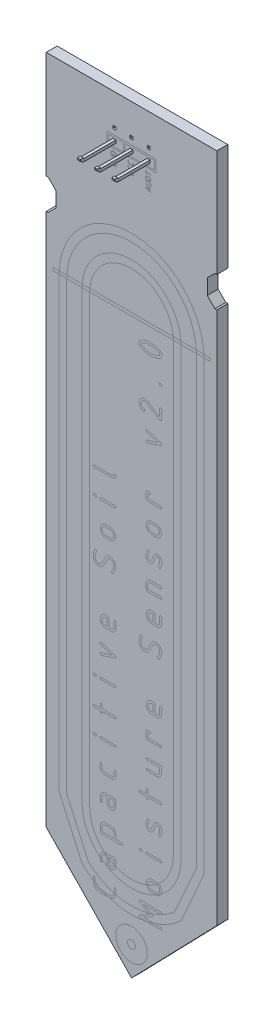
from build123d import *

# Parameters (mm, degrees)
BOSS_EXTRUDE1_DEPTH = 0.715
CUT_EXTRUDE1_REACH  = 52.858
SKETCH7_W           = 10
SKETCH7_H           = 7.4
BOSS_EXTRUDE2_DEPTH = 4.585833323
SHELL1_T            = -0.2
CUT_EXTRUDE2_DEPTH  = 0.2
CUT_EXTRUDE3_REACH  = 56.48
SKETCH10_W          = 0.7
SKETCH10_H          = 2.9
SKETCH11_W          = 9.6
SKETCH11_H          = 0.7
BOSS_EXTRUDE3_DEPTH = 0.2
SKETCH12_W          = 1.5
SKETCH12_H          = 4.6
CUT_EXTRUDE4_DEPTH  = 0.1
SWEEP1_START        = -2.44
SWEEP1_OUTLINE_W    = 0.38
SWEEP1_OUTLINE_H    = 1.2
SWEEP1_DEPTH        = 0.38
LPATTERN1_COUNT     = 3
LPATTERN1_PITCH     = 2.25
CHAMFER3_SIZE       = 0.1
CUT_EXTRUDE6_REACH  = 55.292
SKETCH18_W          = 0.38
SKETCH18_H          = 0.38
CUT_EXTRUDE7_START  = 5.355
SKETCH21_W          = 10
SKETCH21_H          = 7.4
CUT_EXTRUDE7_DEPTH  = 4.6


# Read off the part's stored shape, not the designer's step: Sweep1
with BuildPart() as part:
    # Sketch1 → Boss-Extrude1 (new, symmetric)
    with BuildSketch(Plane.XY):
        Polygon((0, -49.6), (11.15, -38.1), (11.15, 49.6), (-11.15, 49.6), (-11.15, -38.1), align=None)
    extrude(amount=BOSS_EXTRUDE1_DEPTH, both=True)

    # Sketch3 → Cut-Extrude1 (cut, up to next)
    with BuildSketch(Plane.XY.offset(0.715), mode=Mode.PRIVATE) as cut_extrude1_sk1:
        Polygon((-10.897544729, 31.6), (-9.897544729, 32.6), (-9.897544729, 34.6), (-10.897544729, 35.6), (-12.402455271, 35.6), (-12.402455271, 31.6), align=None)
    cut_extrude1_tool1 = extrude(cut_extrude1_sk1.sketch, amount=-CUT_EXTRUDE1_REACH, mode=Mode.PRIVATE) & part.part
    # Sketch3 → Cut-Extrude1 (cut, up to next)
    with BuildSketch(Plane.XY.offset(0.715), mode=Mode.PRIVATE) as cut_extrude1_sk2:
        Polygon((10.897544729, 35.6), (12.402455271, 35.6), (12.402455271, 31.6), (10.897544729, 31.6), (9.897544729, 32.6), (9.897544729, 34.6), align=None)
    cut_extrude1_tool2 = extrude(cut_extrude1_sk2.sketch, amount=-CUT_EXTRUDE1_REACH, mode=Mode.PRIVATE) & part.part
    add(cut_extrude1_tool1.solids().sort_by_distance((-11.251902, 33.6, 0.715))[0], mode=Mode.SUBTRACT)
    add(cut_extrude1_tool2.solids().sort_by_distance((11.251902, 33.6, 0.715))[0], mode=Mode.SUBTRACT)



with BuildPart() as body_2:
    # Sketch7 → Boss-Extrude2 (new body)
    with BuildSketch(Plane.XY.offset(0.915)):
        with Locations((0, 48.04)):
            Rectangle(SKETCH7_W, SKETCH7_H)
    extrude(amount=BOSS_EXTRUDE2_DEPTH)

    # Shell1
    shell1_openings = [body_2.faces().sort_by_distance(p)[0] for p in [
        (0, 51.74, 3.207916661),
    ]]
    offset(amount=SHELL1_T, openings=shell1_openings, kind=Kind.INTERSECTION)

    # Sketch9 → Cut-Extrude2 (cut)
    with BuildSketch(Plane.XY.offset(5.500833323)):
        Polygon((-3, 51.24), (-3, 48.54), (-1.5, 48.54), (-1.5, 51.74), (-2.85, 51.74), (-2.85, 51.615), align=None)
        Polygon((3, 48.54), (3, 51.24), (2.85, 51.615), (2.85, 51.74), (1.5, 51.74), (1.5, 48.54), align=None)
    extrude(amount=-CUT_EXTRUDE2_DEPTH, mode=Mode.SUBTRACT)

    # Cut-Extrude3: up to this face of the body (flat: up to its plane)
    cut_extrude3_end = Plane(body_2.part.faces().sort_by_distance((-5, 48.04, 3.207916661))[0])
    # Sketch10 → Cut-Extrude3 (cut, up to the picked face)
    with BuildSketch(Plane(origin=(5, 0, 0), x_dir=(0, 0, -1), z_dir=(1, 0, 0)), mode=Mode.PRIVATE) as cut_extrude3_sk1:
        with Locations((-4.950833323, 50.29)):
            Rectangle(SKETCH10_W, SKETCH10_H)
    cut_extrude3_tool1 = split(extrude(cut_extrude3_sk1.sketch, amount=-CUT_EXTRUDE3_REACH, mode=Mode.PRIVATE), bisect_by=cut_extrude3_end, keep=Keep.BOTH, mode=Mode.PRIVATE)
    add(cut_extrude3_tool1.solids().sort_by(Axis((5, 50.29, 4.950833), (-1, 0, 0)))[0], mode=Mode.SUBTRACT)

    # Sketch11 → Boss-Extrude3 (add)
    with BuildSketch(Plane(origin=(0, 44.54, 0), x_dir=(1, 0, 0), z_dir=(0, 1, 0))):
        with Locations((0, -4.250833323)):
            Rectangle(SKETCH11_W, SKETCH11_H)
    extrude(amount=BOSS_EXTRUDE3_DEPTH)

    # Sketch12 → Cut-Extrude4 (cut)
    with BuildSketch(Plane.XZ.offset(-44.34)):
        with Locations((-2.25, 3.215)):
            Rectangle(SKETCH12_W, SKETCH12_H)
        with Locations((2.25, 3.215)):
            Rectangle(SKETCH12_W, SKETCH12_H)
        with Locations((0, 3.215)):
            Rectangle(SKETCH12_W, SKETCH12_H)
    extrude(amount=-CUT_EXTRUDE4_DEPTH, mode=Mode.SUBTRACT)


with BuildPart() as part_1:
    add(part.part)

    add(body_2.part)  # Sweep1 merges body 2
    # Sweep1 outline → Sweep1 (add)
    with BuildSketch(Plane.YZ.offset(SWEEP1_START)):
        with BuildLine():
            ThreePointArc((44.214868341, 4.865), (44.247086595, 4.942781746), (44.324868341, 4.975))
            Line((44.324868341, 4.975), (44.44, 4.975))
            Line((44.44, 4.975), (44.44, 5.355))
            Line((44.44, 5.355), (44.324868341, 5.355))
            ThreePointArc((44.324868341, 5.355), (43.978386018, 5.211482323), (43.834868341, 4.865))
            Line((43.834868341, 4.865), (43.834868341, 0.715))
            Line((43.834868341, 0.715), (44.214868341, 0.715))
            Line((44.214868341, 0.715), (44.214868341, 4.865))
        make_face()
        with Locations((44.024868341, -1.315)):
            Rectangle(SWEEP1_OUTLINE_W, SWEEP1_OUTLINE_H)
    sweep1 = extrude(amount=SWEEP1_DEPTH)

    # LPattern1: Sweep1 ×3
    with Locations(*[(i * LPATTERN1_PITCH, 0, 0) for i in range(1, LPATTERN1_COUNT)]):
        add(sweep1)

    # Chamfer3
    chamfer3_edges = [part_1.edges().sort_by_distance(p)[0] for p in [
        (-2.06, 44.024868341, -1.915),
        (-2.25, 43.834868341, -1.915),
        (-2.44, 44.024868341, -1.915),
        (-2.25, 44.214868341, -1.915),
        (0.19, 44.024868341, -1.915),
        (0, 43.834868341, -1.915),
        (-0.19, 44.024868341, -1.915),
        (0, 44.214868341, -1.915),
        (2.44, 44.024868341, -1.915),
        (2.25, 43.834868341, -1.915),
        (2.06, 44.024868341, -1.915),
        (2.25, 44.214868341, -1.915),
    ]]
    chamfer(chamfer3_edges, length=CHAMFER3_SIZE)

    # Sketch18 → Cut-Extrude6 (cut, up to next)
    with BuildSketch(Plane(origin=(0, 0, -0.715), x_dir=(-1, 0, 0), z_dir=(0, 0, -1)), mode=Mode.PRIVATE) as cut_extrude6_sk1:
        with Locations((2.25, 45.524868341)):
            Rectangle(SKETCH18_W, SKETCH18_H)
    cut_extrude6_tool1 = extrude(cut_extrude6_sk1.sketch, amount=-CUT_EXTRUDE6_REACH, mode=Mode.PRIVATE) & part_1.part
    # Sketch18 → Cut-Extrude6 (cut, up to next)
    with BuildSketch(Plane(origin=(0, 0, -0.715), x_dir=(-1, 0, 0), z_dir=(0, 0, -1)), mode=Mode.PRIVATE) as cut_extrude6_sk2:
        with Locations((-2.25, 45.524868341)):
            Rectangle(SKETCH18_W, SKETCH18_H)
    cut_extrude6_tool2 = extrude(cut_extrude6_sk2.sketch, amount=-CUT_EXTRUDE6_REACH, mode=Mode.PRIVATE) & part_1.part
    # Sketch18 → Cut-Extrude6 (cut, up to next)
    with BuildSketch(Plane(origin=(0, 0, -0.715), x_dir=(-1, 0, 0), z_dir=(0, 0, -1)), mode=Mode.PRIVATE) as cut_extrude6_sk3:
        with Locations((0, 45.524868341)):
            Rectangle(SKETCH18_W, SKETCH18_H)
    cut_extrude6_tool3 = extrude(cut_extrude6_sk3.sketch, amount=-CUT_EXTRUDE6_REACH, mode=Mode.PRIVATE) & part_1.part
    add(cut_extrude6_tool1.solids().sort_by_distance((-2.25, 45.524868, -0.715))[0], mode=Mode.SUBTRACT)
    add(cut_extrude6_tool2.solids().sort_by_distance((2.25, 45.524868, -0.715))[0], mode=Mode.SUBTRACT)
    add(cut_extrude6_tool3.solids().sort_by_distance((0, 45.524868, -0.715))[0], mode=Mode.SUBTRACT)

    # Sketch21 → Cut-Extrude7 (cut)
    with BuildSketch(Plane.XY.offset(CUT_EXTRUDE7_START)):
        with Locations((0, 48.04)):
            Rectangle(SKETCH21_W, SKETCH21_H)
    extrude(amount=-CUT_EXTRUDE7_DEPTH, mode=Mode.SUBTRACT)


with BuildPart() as cut_extrude7_kept_piece:
    # of the separate pieces the step leaves, the one the design keeps (cut_extrude7_pieces_kept)
    add(part_1.part.solids().sort_by_distance((-2.44, 44.214868341, -1.815))[0])


solid = cut_extrude7_kept_piece.part
